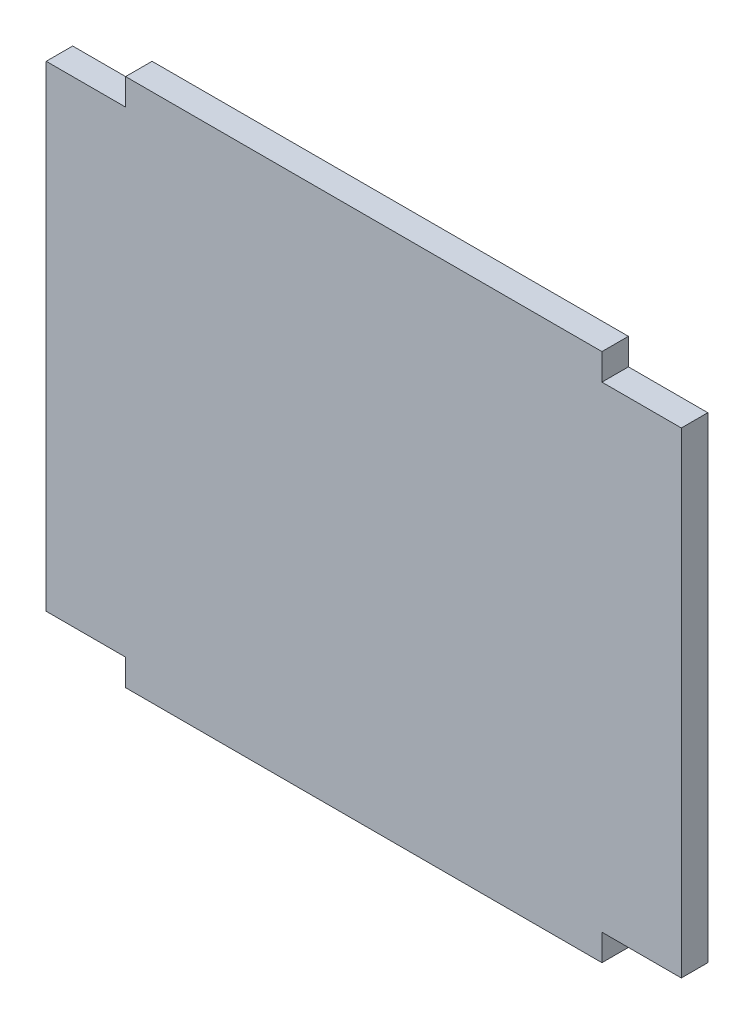
from build123d import *

# Parameters (mm, degrees)
SKETCH1_W           = 76.2
SKETCH1_H           = 63.5
BOSS_EXTRUDE1_DEPTH = 3.175
SKETCH2_W           = 9.525
SKETCH2_H           = 3.175
CUT_EXTRUDE1_DEPTH  = 50.6966108


with BuildPart() as part:
    # Sketch1 → Boss-Extrude1 (new body)
    with BuildSketch(Plane.XY):
        Rectangle(SKETCH1_W, SKETCH1_H)
    extrude(amount=BOSS_EXTRUDE1_DEPTH)

    # Sketch2 → Cut-Extrude1 (cut, through all)
    with BuildSketch(Plane(origin=(0, 0, 0), x_dir=(-1, 0, 0), z_dir=(0, 0, -1))):
        with Locations((-33.3375, -30.1625)):
            Rectangle(SKETCH2_W, SKETCH2_H)
        with Locations((33.3375, -30.1625)):
            Rectangle(SKETCH2_W, SKETCH2_H)
        with Locations((33.3375, 30.1625)):
            Rectangle(SKETCH2_W, SKETCH2_H)
        with Locations((-33.3375, 30.1625)):
            Rectangle(SKETCH2_W, SKETCH2_H)
    extrude(amount=-CUT_EXTRUDE1_DEPTH, mode=Mode.SUBTRACT)


solid = part.part
